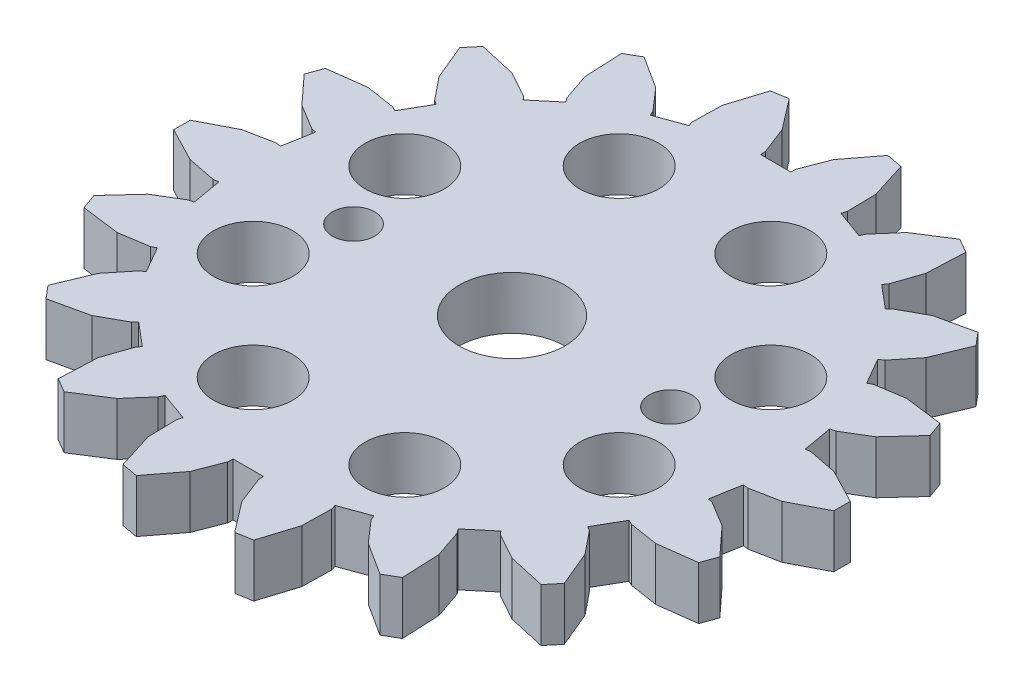
from build123d import *

# Parameters (mm, degrees)
BOSS_EXTRUDE1_DEPTH = 4
CUT_EXTRUDE1_REACH  = 75.812
SKETCH3_R           = 4
SKETCH3_R_2         = 1.6
CUT_EXTRUDE2_REACH  = 75.812
SKETCH4_R           = 3
CIRPATTERN1_COUNT   = 8


with BuildPart() as part:
    # Sketch2 → Boss-Extrude1 (new body)
    with BuildSketch(Plane(origin=(0, 0, 0), x_dir=(1, 0, 0), z_dir=(0, 1, 0))):
        Polygon((47.762485652, 28.947762614), (48.151644834, 28.993511507), (50.314204979, 28.569206144), (52.891842509, 27.230711864), (52.891842509, 25.985875569), (50.314204979, 24.64738129), (48.151644834, 24.223075927), (47.762485652, 24.26882482), (47.364687765, 22.01339285), (47.746189201, 21.923269799), (49.633078836, 20.785048503), (51.597722388, 18.645460901), (51.171846794, 17.475628356), (48.291639591, 17.099624468), (46.114549418, 17.440482175), (45.764463734, 17.616604769), (44.61937085, 15.633112183), (44.946877072, 15.41811298), (46.330727164, 13.703026236), (47.445189759, 11.020736322), (46.644881204, 10.066885332), (43.809638126, 10.698728344), (41.880533139, 11.763515425), (41.611734913, 12.048806991), (39.857182288, 10.576600966), (40.091620493, 10.26244623), (40.805339538, 8.177638611), (40.935124663, 5.276029792), (39.856986096, 4.653415452), (37.408741307, 6.216726184), (35.960097095, 7.877228441), (35.80517923, 8.237328261), (33.65302491, 7.453905429), (33.765728119, 7.078490812), (33.723317272, 4.875286939), (32.852913242, 2.104248708), (31.626729093, 1.888070961), (29.860985181, 4.194160796), (29.0677451, 6.250105246), (29.045164941, 6.64142393), (26.754979175, 6.64142393), (26.732399712, 6.250105246), (25.939159631, 4.194160796), (24.173415719, 1.888070961), (22.947231569, 2.104248708), (22.07682754, 4.875286939), (22.034416692, 7.078490812), (22.147119206, 7.453905429), (19.994964886, 8.237328261), (19.840047716, 7.877228441), (18.391403505, 6.216726184), (15.943158715, 4.653415452), (14.865019453, 5.276029792), (14.994804578, 8.177638611), (15.708524319, 10.26244623), (15.942961828, 10.576600966), (14.188409899, 12.048806991), (13.919610977, 11.763515425), (11.990506685, 10.698728344), (9.155262912, 10.066885332), (8.354954357, 11.020736322), (9.469417647, 13.703026236), (10.85326774, 15.41811298), (11.180773961, 15.633112183), (10.035681078, 17.616604769), (9.685594698, 17.440482175), (7.508504525, 17.099624468), (4.628298017, 17.475628356), (4.202422424, 18.645460901), (6.16706528, 20.785048503), (8.053955611, 21.923269799), (8.435457047, 22.01339285), (8.037658464, 24.26882482), (7.648499977, 24.223075927), (5.485939137, 24.64738129), (2.908302302, 25.985875569), (2.908302302, 27.230711864), (5.485939137, 28.569206144), (7.648499977, 28.993511507), (8.037658464, 28.947762614), (8.435457047, 31.203194583), (8.053955611, 31.293317634), (6.16706528, 32.431538931), (4.202422424, 34.571126533), (4.628298017, 35.740959077), (7.508504525, 36.116962965), (9.685594698, 35.776105258), (10.035681078, 35.599982665), (11.180773961, 37.583475251), (10.85326774, 37.798474454), (9.469417647, 39.513561197), (8.354954357, 42.195851112), (9.155262912, 43.149702102), (11.990506685, 42.517859089), (13.919610977, 41.453072008), (14.188409899, 41.167780443), (15.942961828, 42.639986468), (15.708524319, 42.954141203), (14.994804578, 45.038948823), (14.865019453, 47.940557642), (15.943158715, 48.563171981), (18.391403505, 46.99986125), (19.840047716, 45.339358993), (19.994964886, 44.979259173), (22.147119206, 45.762682005), (22.034416692, 46.138096622), (22.07682754, 48.341300495), (22.947231569, 51.112338726), (24.173415719, 51.328516472), (25.939159631, 49.022426638), (26.732399712, 46.966482188), (26.754979175, 46.575163503), (29.045164941, 46.575163503), (29.0677451, 46.966482188), (29.860985181, 49.022426638), (31.626729093, 51.328516472), (32.852913242, 51.112338726), (33.723317272, 48.341300495), (33.765728119, 46.138096622), (33.65302491, 45.762682005), (35.80517923, 44.979259173), (35.960097095, 45.339358993), (37.408741307, 46.99986125), (39.856986096, 48.563171981), (40.935124663, 47.940557642), (40.805339538, 45.038948823), (40.091620493, 42.954141203), (39.857182288, 42.639986468), (41.611734913, 41.167780443), (41.880533139, 41.453072008), (43.809638126, 42.517859089), (46.644881204, 43.149702102), (47.445189759, 42.195851112), (46.330727164, 39.513561197), (44.946877072, 37.798474454), (44.61937085, 37.583475251), (45.764463734, 35.599982665), (46.114549418, 35.776105258), (48.291639591, 36.116962965), (51.171846794, 35.740959077), (51.597722388, 34.571126533), (49.633078836, 32.431538931), (47.746189201, 31.293317634), (47.364687765, 31.203194583), align=None)
    extrude(amount=BOSS_EXTRUDE1_DEPTH)

    # Sketch3 → Cut-Extrude1 (cut, up to next)
    with BuildSketch(Plane(origin=(0, 0, 0), x_dir=(1, 0, 0), z_dir=(0, 1, 0)), mode=Mode.PRIVATE) as cut_extrude1_sk1:
        with Locations((27.900072058, 26.608293717)):
            Circle(SKETCH3_R)
    cut_extrude1_tool1 = extrude(cut_extrude1_sk1.sketch, amount=CUT_EXTRUDE1_REACH, mode=Mode.PRIVATE) & part.part
    # Sketch3 → Cut-Extrude1 (cut, up to next)
    with BuildSketch(Plane(origin=(0, 0, 0), x_dir=(1, 0, 0), z_dir=(0, 1, 0)), mode=Mode.PRIVATE) as cut_extrude1_sk2:
        with Locations((15.900072058, 26.608293717)):
            Circle(SKETCH3_R_2)
    cut_extrude1_tool2 = extrude(cut_extrude1_sk2.sketch, amount=CUT_EXTRUDE1_REACH, mode=Mode.PRIVATE) & part.part
    # Sketch3 → Cut-Extrude1 (cut, up to next)
    with BuildSketch(Plane(origin=(0, 0, 0), x_dir=(1, 0, 0), z_dir=(0, 1, 0)), mode=Mode.PRIVATE) as cut_extrude1_sk3:
        with Locations((39.900072058, 26.608293717)):
            Circle(SKETCH3_R_2)
    cut_extrude1_tool3 = extrude(cut_extrude1_sk3.sketch, amount=CUT_EXTRUDE1_REACH, mode=Mode.PRIVATE) & part.part
    add(cut_extrude1_tool1.solids().sort_by_distance((27.900072, 0, -26.608294))[0], mode=Mode.SUBTRACT)
    add(cut_extrude1_tool2.solids().sort_by_distance((15.900072, 0, -26.608294))[0], mode=Mode.SUBTRACT)
    add(cut_extrude1_tool3.solids().sort_by_distance((39.900072, 0, -26.608294))[0], mode=Mode.SUBTRACT)

    # Sketch4 → Cut-Extrude2 (cut, up to next)
    with BuildSketch(Plane(origin=(0, 0, 0), x_dir=(1, 0, 0), z_dir=(0, 1, 0)), mode=Mode.PRIVATE) as cut_extrude2_sk1:
        with Locations((14.04187907, 32.348545202)):
            Circle(SKETCH4_R)
    cut_extrude2_tool1 = extrude(cut_extrude2_sk1.sketch, amount=CUT_EXTRUDE2_REACH, mode=Mode.PRIVATE) & part.part
    cut_extrude2 = cut_extrude2_tool1.solids().sort_by_distance((14.041879, 0, -32.348545))[0]
    add(cut_extrude2, mode=Mode.SUBTRACT)

    # CirPattern1: Cut-Extrude2 ×8 about axis
    cirpattern1_axis = Axis((27.900072058, 4, -26.608293717), (0, -1, 0))
    for i in range(1, CIRPATTERN1_COUNT):
        add(cut_extrude2.rotate(cirpattern1_axis, i * 360 / CIRPATTERN1_COUNT), mode=Mode.SUBTRACT)


solid = part.part
